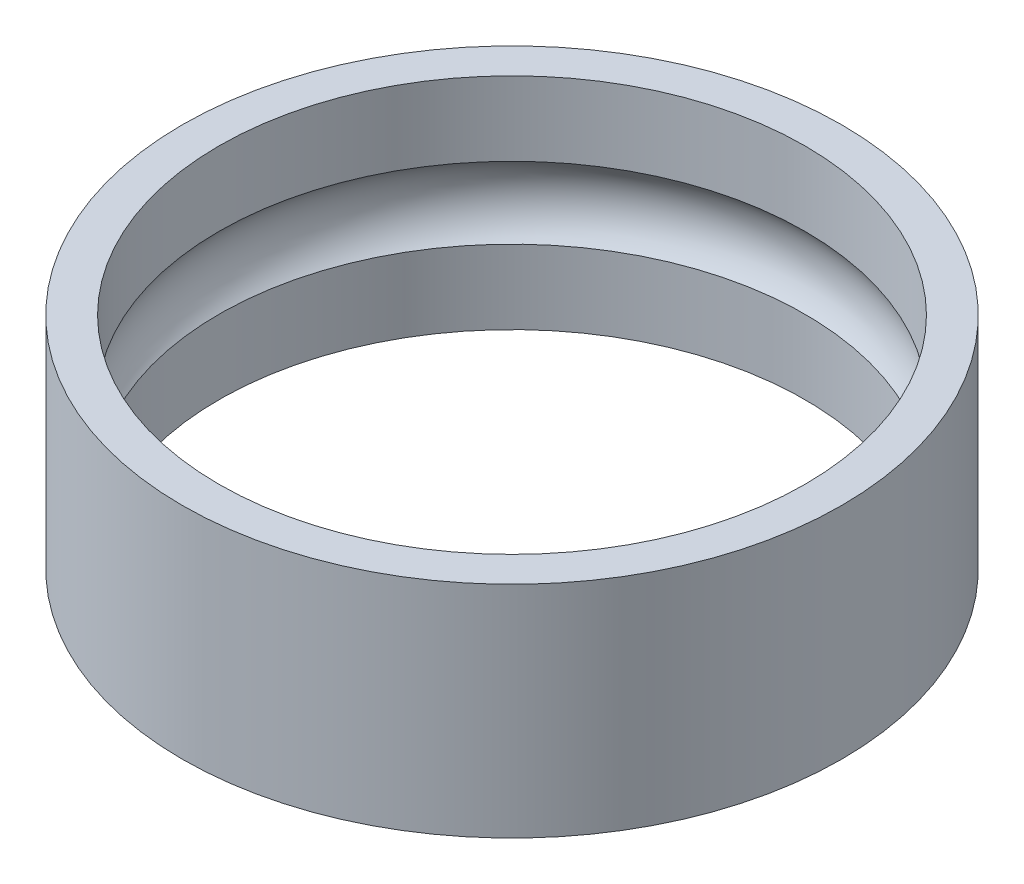
from build123d import *

# Parameters (mm, degrees)
DIAPROFILES_R         = 4.5
DIAPROFILES_R_2       = 4
DIAPROFILE_DEPTH      = 1.5
BEARINGPATHPROFILES_R = 0.7


with BuildPart() as part:
    # DiaProfileS → DiaProfile (new, symmetric)
    with BuildSketch(Plane(origin=(0, 0, 0), x_dir=(1, 0, 0), z_dir=(0, 1, 0))):
        Circle(DIAPROFILES_R)
        Circle(DIAPROFILES_R_2, mode=Mode.SUBTRACT)
    extrude(amount=DIAPROFILE_DEPTH, both=True)

    # BearingPathProfileS → BearingPathProfile (revolve, cut)
    with BuildSketch(Plane.XY):
        with Locations((3.5, 0)):
            Circle(BEARINGPATHPROFILES_R)
    revolve(axis=Axis((0, 1.5, 0), (0, -1, 0)), mode=Mode.SUBTRACT)


solid = part.part
